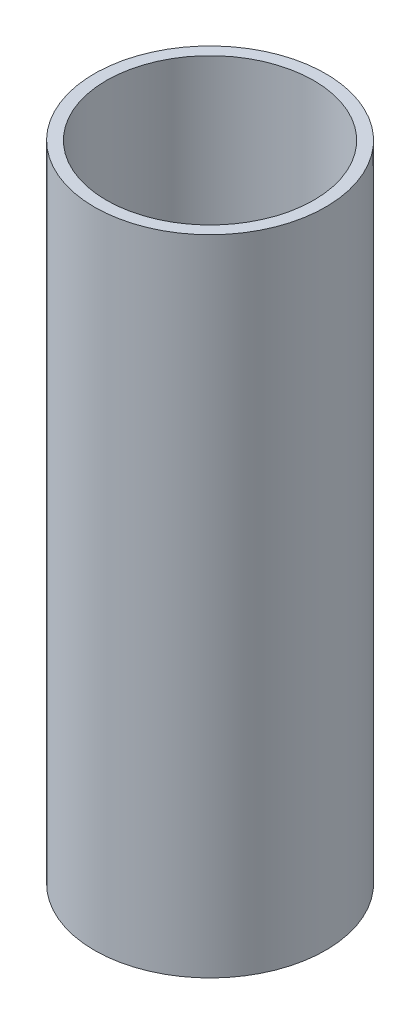
from build123d import *

# Parameters (mm, degrees)
SKETCH1_R           = 55
BOSS_EXTRUDE1_DEPTH = 306.200191863
SKETCH2_R           = 49.335289326
CUT_EXTRUDE1_DEPTH  = 316.92492383


with BuildPart() as part:
    # Sketch1 → Boss-Extrude1 (new body)
    with BuildSketch(Plane(origin=(0, 0, 0), x_dir=(1, 0, 0), z_dir=(0, 1, 0))):
        Circle(SKETCH1_R)
    extrude(amount=BOSS_EXTRUDE1_DEPTH)

    # Sketch2 → Cut-Extrude1 (cut, through all)
    with BuildSketch(Plane(origin=(0, 0, 0), x_dir=(1, 0, 0), z_dir=(0, 1, 0))):
        Circle(SKETCH2_R)
    extrude(amount=CUT_EXTRUDE1_DEPTH, mode=Mode.SUBTRACT)


solid = part.part
